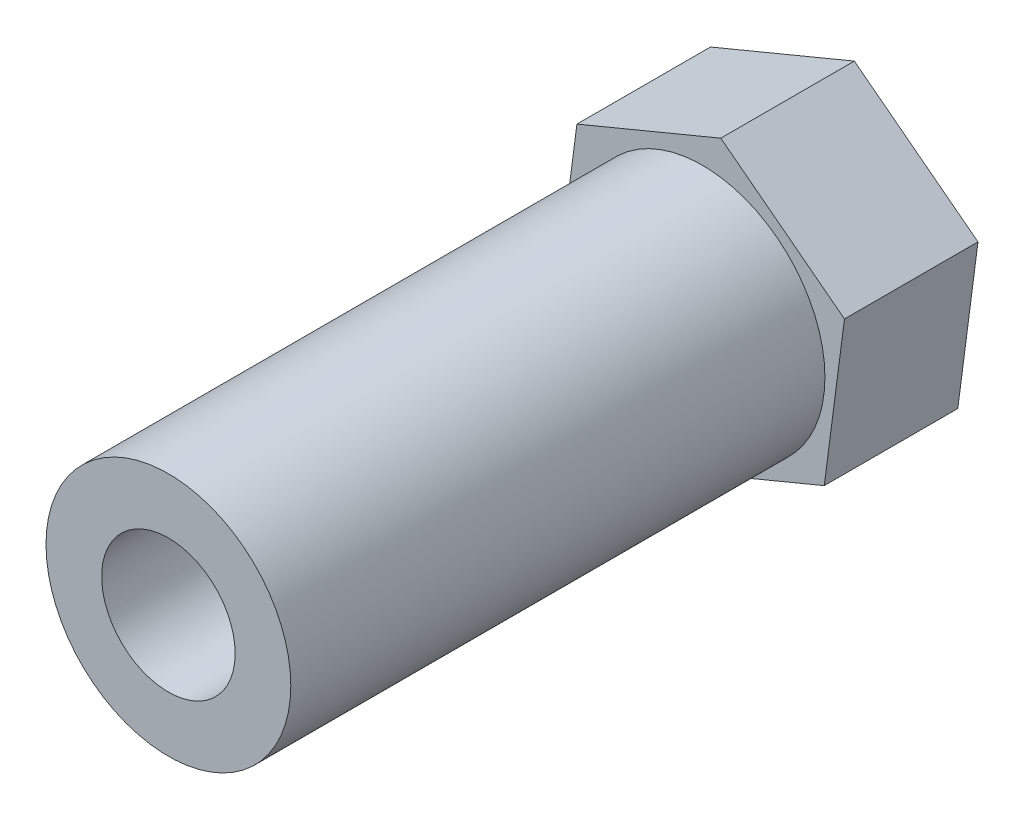
from build123d import *

# Parameters (mm, degrees)
BOSS_EXTRUDE1_DEPTH = 6
SKETCH3_R           = 5.5
BOSS_EXTRUDE2_DEPTH = 24
SKETCH4_R           = 1.5
CUT_EXTRUDE1_DEPTH  = 6
SKETCH5_R           = 3
CUT_EXTRUDE2_DEPTH  = 24


with BuildPart() as part:
    # Sketch1 → Boss-Extrude1 (new body)
    with BuildSketch(Plane.XY):
        Polygon((1.007375499, -2.307214853), (1.915616407, 4.633613516), (-3.64119683, 8.8905874), (-10.106250976, 6.206732914), (-11.014491883, -0.734095455), (-5.457678646, -4.991069339), align=None)
    extrude(amount=BOSS_EXTRUDE1_DEPTH)

    # Sketch3 → Boss-Extrude2 (add)
    with BuildSketch(Plane.XY.offset(6)):
        with Locations((-4.462077205, 1.925315909)):
            Circle(SKETCH3_R)
    extrude(amount=BOSS_EXTRUDE2_DEPTH)

    # Sketch4 → Cut-Extrude1 (cut)
    with BuildSketch(Plane(origin=(0, 0, 0), x_dir=(-1, 0, 0), z_dir=(0, 0, -1))):
        with Locations((4.462077205, 1.925315909)):
            Circle(SKETCH4_R)
    extrude(amount=-CUT_EXTRUDE1_DEPTH, mode=Mode.SUBTRACT)

    # Sketch5 → Cut-Extrude2 (cut)
    with BuildSketch(Plane.XY.offset(30)):
        with Locations((-4.462077205, 1.925315909)):
            Circle(SKETCH5_R)
    extrude(amount=-CUT_EXTRUDE2_DEPTH, mode=Mode.SUBTRACT)


solid = part.part
